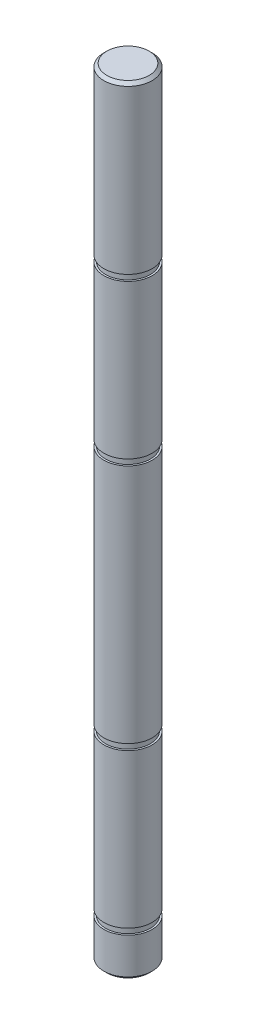
from build123d import *

# Parameters (mm, degrees)
SKIZZE1_R                       = 4
AUFSATZ_LINEAR_AUSTRAGEN1_DEPTH = 117
SKIZZE4_R                       = 4
AUFSATZ_LINEAR_AUSTRAGEN3_DEPTH = 7
AUFSATZ_LINEAR_START            = 4.87
SKIZZE5_R                       = 4
AUFSATZ_LINEAR_AUSTRAGEN4_DEPTH = 4.87
SCHNITT_LINEAR_START            = 1
SKIZZE6_R                       = 4
SKIZZE6_R_2                     = 3.7
SCHNITT_LINEAR_AUSTRAGEN1_DEPTH = 1
SKIZZE7_R                       = 4
SKIZZE7_R_2                     = 3.7
SCHNITT_LINEAR_AUSTRAGEN2_DEPTH = 1
SKIZZE8_R                       = 4
SKIZZE8_R_2                     = 3.7
SCHNITT_LINEAR_AUSTRAGEN3_DEPTH = 1
SCHNITT_LINEAR_START_2          = -1
SKIZZE9_R                       = 4
SKIZZE9_R_2                     = 3.7
SCHNITT_LINEAR_AUSTRAGEN4_DEPTH = 1
FASE1_SIZE                      = 0.5


with BuildPart() as part:
    # Skizze1 → Aufsatz-Linear austragen1 (new body)
    with BuildSketch(Plane(origin=(0, 0, 0), x_dir=(1, 0, 0), z_dir=(0, 1, 0))):
        Circle(SKIZZE1_R)
    extrude(amount=AUFSATZ_LINEAR_AUSTRAGEN1_DEPTH)

    # Skizze4 → Aufsatz-Linear austragen3 (add)
    with BuildSketch(Plane(origin=(0, 117, 0), x_dir=(1, 0, 0), z_dir=(0, 1, 0))):
        Circle(SKIZZE4_R)
    extrude(amount=AUFSATZ_LINEAR_AUSTRAGEN3_DEPTH)

    # Skizze5 → Aufsatz-Linear austragen4 (add)
    with BuildSketch(Plane.XZ.offset(AUFSATZ_LINEAR_START)):
        Circle(SKIZZE5_R)
    extrude(amount=-AUFSATZ_LINEAR_AUSTRAGEN4_DEPTH)

    # Skizze6 → Schnitt-Linear austragen1 (cut)
    with BuildSketch(Plane(origin=(0, 2.63, 0), x_dir=(-1, 0, 0), z_dir=(0, -1, 0)).offset(SCHNITT_LINEAR_START)):
        Circle(SKIZZE6_R)
        Circle(SKIZZE6_R_2, mode=Mode.SUBTRACT)
    extrude(amount=-SCHNITT_LINEAR_AUSTRAGEN1_DEPTH, mode=Mode.SUBTRACT)

    # Skizze7 → Schnitt-Linear austragen2 (cut)
    with BuildSketch(Plane(origin=(0, 95.5, 0), x_dir=(1, 0, 0), z_dir=(0, 1, 0))):
        Circle(SKIZZE7_R)
        Circle(SKIZZE7_R_2, mode=Mode.SUBTRACT)
    extrude(amount=SCHNITT_LINEAR_AUSTRAGEN2_DEPTH, mode=Mode.SUBTRACT)

    # Skizze8 → Schnitt-Linear austragen3 (cut)
    with BuildSketch(Plane(origin=(0, 28.13, 0), x_dir=(-1, 0, 0), z_dir=(0, -1, 0))):
        Circle(SKIZZE8_R)
        Circle(SKIZZE8_R_2, mode=Mode.SUBTRACT)
    extrude(amount=-SCHNITT_LINEAR_AUSTRAGEN3_DEPTH, mode=Mode.SUBTRACT)

    # Skizze9 → Schnitt-Linear austragen4 (cut)
    with BuildSketch(Plane(origin=(0, 70, 0), x_dir=(1, 0, 0), z_dir=(0, 1, 0)).offset(SCHNITT_LINEAR_START_2)):
        Circle(SKIZZE9_R)
        Circle(SKIZZE9_R_2, mode=Mode.SUBTRACT)
    extrude(amount=SCHNITT_LINEAR_AUSTRAGEN4_DEPTH, mode=Mode.SUBTRACT)

    # Fase1
    fase1_edges = [part.edges().sort_by_distance(p)[0] for p in [
        (-4, -4.87, 0),
        (-4, 124, 0),
    ]]
    chamfer(fase1_edges, length=FASE1_SIZE)


solid = part.part
